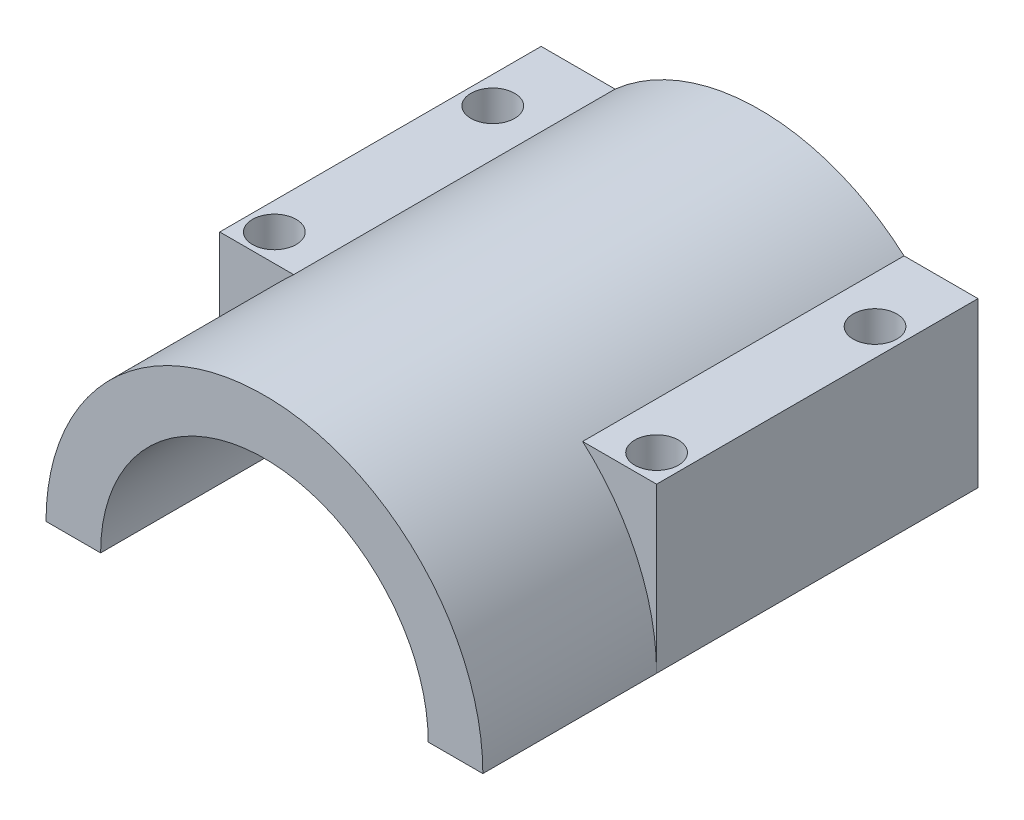
from build123d import *

# Parameters (mm, degrees)
BOSS_EXTRUDE1_DEPTH      = 52.578
BOSS_EXTRUDE2_START      = 5
SKETCH3_R                = 6
BOSS_EXTRUDE2_DEPTH      = 5
SKETCH4_R                = 2.54
CUT_EXTRUDE1_DEPTH       = 64.677045189
SKETCH5_R                = 3.175
SKETCH5_R_2              = 2.54
BOSS_EXTRUDE3_DEPTH      = 19.05
BOSS_EXTRUDE4_REACH      = 63.421
BOSS_EXTRUDE4_END_RADIUS = 25.4
SKETCH6_W                = 8.89
SKETCH6_H                = 37.375
SKETCH6_R                = 2.54


with BuildPart() as part:
    # Sketch2 → Boss-Extrude1 (new body)
    with BuildSketch(Plane.XY):
        with BuildLine():
            Line((-19.05, 0), (-25.4, 0))
            ThreePointArc((-25.4, 0), (0, 25.4), (25.4, 0))
            Line((25.4, 0), (19.05, 0))
            ThreePointArc((19.05, 0), (0, 19.05), (-19.05, 0))
        make_face()
    extrude(amount=BOSS_EXTRUDE1_DEPTH)

    # Sketch3 → Boss-Extrude2 (add)
    with BuildSketch(Plane(origin=(0, 0, 0), x_dir=(-1, 0, 0), z_dir=(0, 0, -1)).offset(BOSS_EXTRUDE2_START)):
        with BuildLine():
            Line((-25.4, 0), (25.4, 0))
            ThreePointArc((25.4, 0), (0, 25.4), (-25.4, 0))
        make_face()
        with Locations((0, 7)):
            Circle(SKETCH3_R, mode=Mode.SUBTRACT)
    extrude(amount=-BOSS_EXTRUDE2_DEPTH)

    # Sketch4 → Cut-Extrude1 (cut, through all)
    with BuildSketch(Plane(origin=(0, 0, 0), x_dir=(1, 0, 0), z_dir=(0, 1, 0))):
        with Locations((-22.225, -3.8)):
            Circle(SKETCH4_R)
        with Locations((22.225, -3.8)):
            Circle(SKETCH4_R)
        with Locations((22.225, -29.2)):
            Circle(SKETCH4_R)
        with Locations((-22.225, -29.2)):
            Circle(SKETCH4_R)
    extrude(amount=CUT_EXTRUDE1_DEPTH, mode=Mode.SUBTRACT)

    # Sketch5 → Boss-Extrude3 (add)
    # profile 1 of 4: a face of its own
    with BuildSketch(Plane.XZ):
        with Locations((-22.225, 29.2)):
            Circle(SKETCH5_R)
        with Locations((-22.225, 29.2)):
            Circle(SKETCH5_R_2, mode=Mode.SUBTRACT)
    # profile 2 of 4: a face of its own
    with BuildSketch(Plane.XZ):
        with Locations((-22.225, 3.8)):
            Circle(SKETCH5_R)
        with Locations((-22.225, 3.8)):
            Circle(SKETCH5_R_2, mode=Mode.SUBTRACT)
    # profile 3 of 4: a face of its own
    with BuildSketch(Plane.XZ):
        with Locations((22.225, 3.8)):
            Circle(SKETCH5_R)
        with Locations((22.225, 3.8)):
            Circle(SKETCH5_R_2, mode=Mode.SUBTRACT)
    # profile 4 of 4: a face of its own
    with BuildSketch(Plane.XZ):
        with Locations((22.225, 29.2)):
            Circle(SKETCH5_R)
        with Locations((22.225, 29.2)):
            Circle(SKETCH5_R_2, mode=Mode.SUBTRACT)
    extrude(amount=-BOSS_EXTRUDE3_DEPTH)

    # Boss-Extrude4: up to this cylinder (the profile starts outside it)
    boss_extrude4_end = Plane(origin=(0, 0, 13.296692), z_dir=(0, 0, -1)) * Cylinder(BOSS_EXTRUDE4_END_RADIUS, 178.642, mode=Mode.PRIVATE)
    # Sketch6 → Boss-Extrude4 (add, up to the surface)
    with BuildSketch(Plane(origin=(0, 19.05, 0), x_dir=(1, 0, 0), z_dir=(0, 1, 0)), mode=Mode.PRIVATE) as boss_extrude4_sk1:
        with Locations((-20.955, -13.6875)):
            Rectangle(SKETCH6_W, SKETCH6_H)
        with Locations((-22.225, -29.2)):
            Circle(SKETCH6_R, mode=Mode.SUBTRACT)
        with Locations((-22.225, -3.8)):
            Circle(SKETCH6_R, mode=Mode.SUBTRACT)
    boss_extrude4_tool1 = extrude(boss_extrude4_sk1.sketch, amount=-BOSS_EXTRUDE4_REACH, mode=Mode.PRIVATE) - boss_extrude4_end
    boss_extrude4 = boss_extrude4_tool1.solids().sort_by_distance((-20.778529, 19.05, 13.296692))[0]
    add(boss_extrude4)

    # Mirror1: Boss-Extrude4 across plane
    add(boss_extrude4.mirror(Plane(origin=(0, 0, 0), x_dir=(0, 0, 1), z_dir=(1, 0, 0))))


solid = part.part
